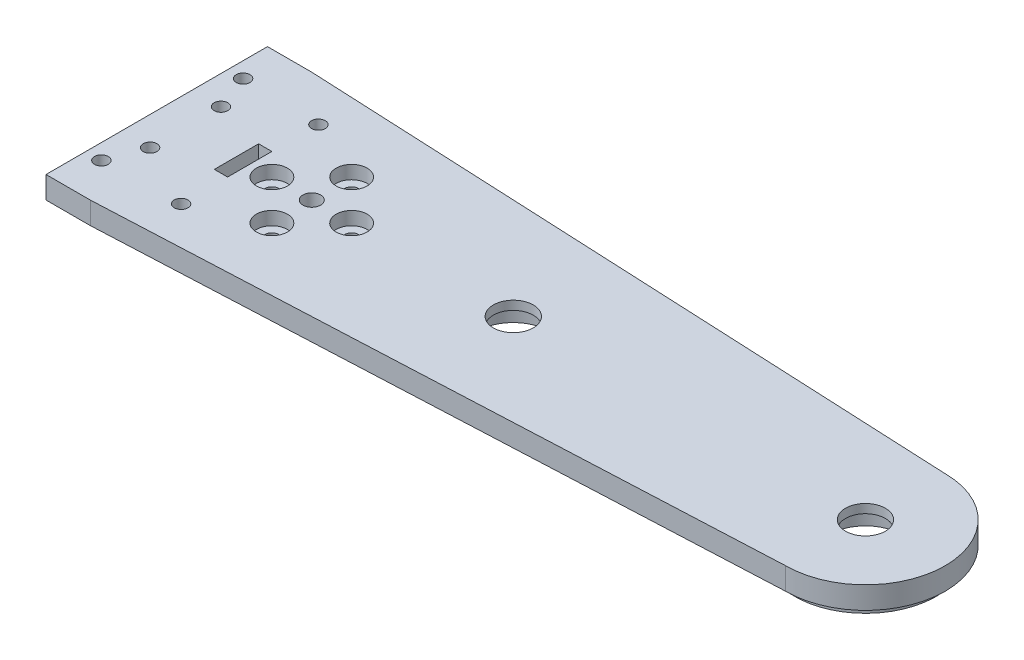
from build123d import *

# Parameters (mm, degrees)
SKETCH28_R           = 1.55
SKETCH28_R_2         = 4.5
SKETCH28_R_3         = 2
SKETCH28_W           = 10
SKETCH28_H           = 3
BOSS_EXTRUDE10_DEPTH = 5
SKETCH29_R           = 16
BOSS_EXTRUDE11_DEPTH = 2
SKETCH30_R           = 8.2
CUT_EXTRUDE1_DEPTH   = 5
SKETCH31_R           = 3.5
CUT_EXTRUDE2_DEPTH   = 3


with BuildPart() as part:
    # Sketch28 → Boss-Extrude10 (new body)
    with BuildSketch(Plane(origin=(-32, 0, 0), x_dir=(0, 0, 1), z_dir=(0, -1, 0))):
        with BuildLine():
            Line((-25, 15), (25, 15))
            Line((25, 15), (25, 5))
            Line((25, 5), (18, -145))
            ThreePointArc((18, -145), (0, -163), (-18, -145))
            Line((-18, -145), (-25, 5))
            Line((-25, 5), (-25, 15))
        make_face()
        with Locations((8, 8.5)):
            Circle(SKETCH28_R, mode=Mode.SUBTRACT)
        with Locations((-8, 8.5)):
            Circle(SKETCH28_R, mode=Mode.SUBTRACT)
        with Locations((16, 11.5)):
            Circle(SKETCH28_R, mode=Mode.SUBTRACT)
        with Locations((-16, 11.5)):
            Circle(SKETCH28_R, mode=Mode.SUBTRACT)
        with Locations((-15.5, -6)):
            Circle(SKETCH28_R, mode=Mode.SUBTRACT)
        with Locations((15.5, -6)):
            Circle(SKETCH28_R, mode=Mode.SUBTRACT)
        with Locations((0, -65.5)):
            Circle(SKETCH28_R_2, mode=Mode.SUBTRACT)
        with Locations((0, -20)):
            Circle(SKETCH28_R_3, mode=Mode.SUBTRACT)
        with Locations((0, -145)):
            Circle(SKETCH28_R_2, mode=Mode.SUBTRACT)
        with Locations((-9, -20)):
            Circle(SKETCH28_R, mode=Mode.SUBTRACT)
        with Locations((0, -11)):
            Circle(SKETCH28_R, mode=Mode.SUBTRACT)
        with Locations((9, -20)):
            Circle(SKETCH28_R, mode=Mode.SUBTRACT)
        with Locations((0, -29)):
            Circle(SKETCH28_R, mode=Mode.SUBTRACT)
        with Locations((0, -4.5)):
            Rectangle(SKETCH28_W, SKETCH28_H, mode=Mode.SUBTRACT)
    extrude(amount=BOSS_EXTRUDE10_DEPTH)

    # Sketch29 → Boss-Extrude11 (add)
    with BuildSketch(Plane.XZ.offset(5)):
        with Locations((33.5, 0)):
            Circle(SKETCH29_R)
        with Locations((113, 0)):
            Circle(SKETCH29_R)
    extrude(amount=BOSS_EXTRUDE11_DEPTH)

    # Sketch30 → Cut-Extrude1 (cut)
    with BuildSketch(Plane.XZ.offset(7)):
        with Locations((33.5, 0)):
            Circle(SKETCH30_R)
        with Locations((113, 0)):
            Circle(SKETCH30_R)
    extrude(amount=-CUT_EXTRUDE1_DEPTH, mode=Mode.SUBTRACT)

    # Sketch31 → Cut-Extrude2 (cut)
    with BuildSketch(Plane(origin=(0, 0, 0), x_dir=(1, 0, 0), z_dir=(0, 1, 0))):
        with Locations((-12, 9)):
            Circle(SKETCH31_R)
        with Locations((-3, 0)):
            Circle(SKETCH31_R)
        with Locations((-12, -9)):
            Circle(SKETCH31_R)
        with Locations((-21, 0)):
            Circle(SKETCH31_R)
    extrude(amount=-CUT_EXTRUDE2_DEPTH, mode=Mode.SUBTRACT)


solid = part.part
